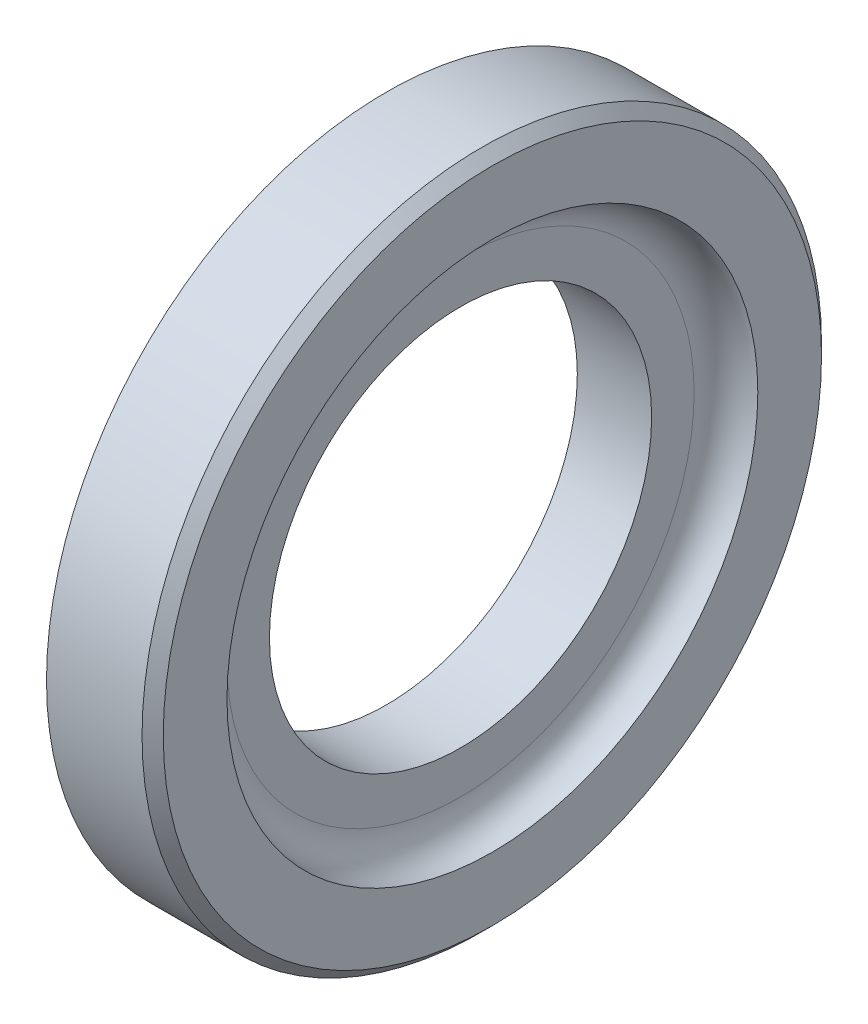
from build123d import *

# Parameters (mm, degrees)
SKETCH1_W         = 10
SKETCH1_H         = 32
FILLET1_R         = 3
CIRPATTERN1_COUNT = 4
CHAMFER1_SIZE     = 1


with BuildPart() as part:
    # Sketch1 → Revolve1 (revolve)
    with BuildSketch(Plane.XY, mode=Mode.PRIVATE) as revolve1_sk:
        with Locations((-5, 16)):
            Rectangle(SKETCH1_W, SKETCH1_H)
    revolve(revolve1_sk.sketch.rotate(Axis((0, 0, 0), (-1, 0, 0)), 90), axis=Axis((0, 0, 0), (-1, 0, 0)))

    # Sketch2 → Cut-Revolve1 (revolve, cut)
    with BuildSketch(Plane.XY, mode=Mode.PRIVATE) as cut_revolve1_sk:
        Polygon((0, 0), (0, 25), (-3, 25), (-3, 18), (-10, 18), (-10, 0), align=None)
    revolve(cut_revolve1_sk.sketch.rotate(Axis((0, 0, 0), (-1, 0, 0)), 90), axis=Axis((0, 0, 0), (-1, 0, 0)), mode=Mode.SUBTRACT)

    # Fillet1
    fillet1_edges = [part.edges().sort_by_distance(p)[0] for p in [
        (-3, 0, 25),
    ]]
    fillet(fillet1_edges, radius=FILLET1_R - 0.0001)  # a hair under: the kernel refuses the full size

    # Sketch4 → Ø3.0mm Dowel Hole1 (revolve, cut)
    with BuildSketch(Plane(origin=(-10, 25, 0), x_dir=(0, 0, 1), z_dir=(0, 1, 0))):
        Polygon((0, 0), (0, 3.901290929), (1.5, 3), (1.5, 0), align=None)
    f_3_0mm_dowel_hole1 = revolve(axis=Axis((-16.35, 25, 0), (1, 0, 0)), mode=Mode.SUBTRACT)

    # CirPattern1: Ø3.0mm Dowel Hole1 ×4 about axis
    cirpattern1_axis = Axis((0, 0, 0), (1, 0, 0))
    for i in range(1, CIRPATTERN1_COUNT):
        add(f_3_0mm_dowel_hole1.rotate(cirpattern1_axis, i * 360 / CIRPATTERN1_COUNT), mode=Mode.SUBTRACT)

    # Chamfer1
    chamfer1_edges = [part.edges().sort_by_distance(p)[0] for p in [
        (0, 0, 32),
    ]]
    chamfer(chamfer1_edges, length=CHAMFER1_SIZE)


solid = part.part
